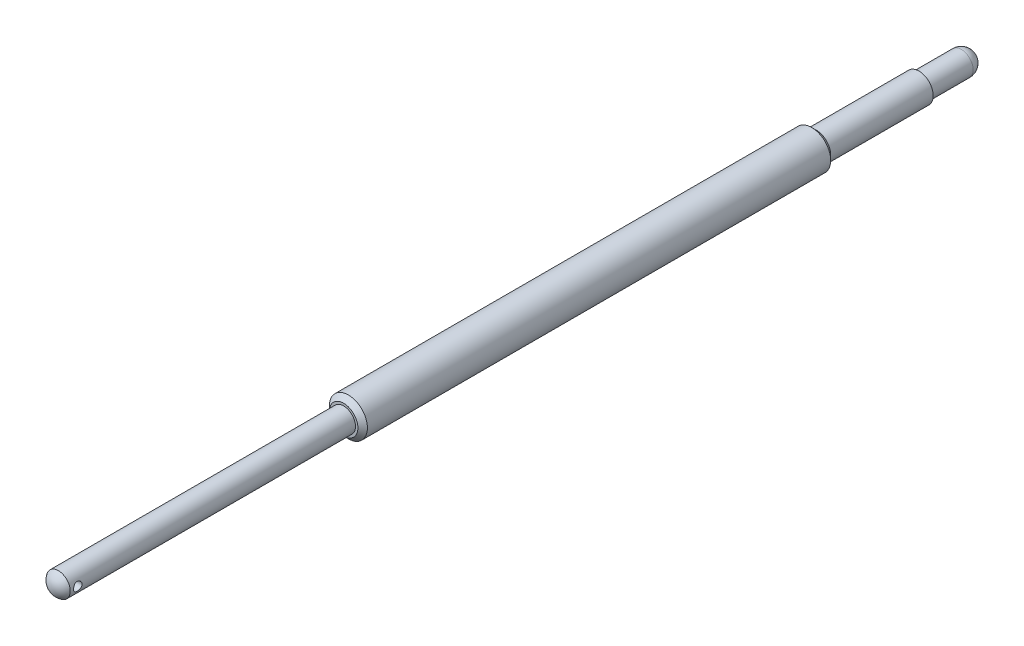
from build123d import *

# Parameters (mm, degrees)
CHAMFER1_SIZE           = 0.5
CUT_EXTRUDE1_DEPTH      = 67.260395411
CUT_EXTRUDE1_DEPTH_BACK = 67.260395411
SKETCH3_R               = 0.45


with BuildPart() as part:
    # Sketch2 → Revolve1 (revolve)
    with BuildSketch(Plane(origin=(0, 0, 0), x_dir=(0, 0, -1), z_dir=(1, 0, 0)), mode=Mode.PRIVATE) as revolve1_sk:
        with BuildLine():
            Line((-29.233928571, 0), (65.5, 0))
            Line((65.5, 0), (66.2, 0))
            ThreePointArc((66.2, 0), (65.833883476, -0.883883476), (64.95, -1.25))
            Line((64.95, -1.25), (60.5, -1.25))
            Line((60.5, -1.25), (60.5, -1.5))
            Line((60.5, -1.5), (49.719225947, -1.5))
            Line((49.719225947, -1.5), (49.719225947, -2))
            Line((49.719225947, -2), (0, -2))
            Line((0, -2), (0, -1.25))
            Line((0, -1.25), (-5, -1.25))
            Line((-5, -1.25), (-30, -1.25))
            ThreePointArc((-30, -1.25), (-30.513084713, -0.716327439), (-30.7, 0))
            Line((-30.7, 0), (-29.233928571, 0))
        make_face()
    revolve(revolve1_sk.sketch.rotate(Axis((0, 0, 29.233928571), (0, 0, -1)), 270), axis=Axis((0, 0, 29.233928571), (0, 0, -1)))

    # Chamfer1
    chamfer1_edges = [part.edges().sort_by_distance(p)[0] for p in [
        (-2, 0, -49.719225947),
        (-2, 0, 0),
    ]]
    chamfer(chamfer1_edges, length=CHAMFER1_SIZE - 0.0001)  # a hair under: the kernel refuses the full size

    # Sketch3 → Cut-Extrude1 (cut, two sides: drawn at the far end of the back side and taken through both)
    with BuildSketch(Plane(origin=(0, 0, 0), x_dir=(0, 0, -1), z_dir=(1, 0, 0)).offset(-CUT_EXTRUDE1_DEPTH_BACK)):
        with Locations((-29.2, 0)):
            Circle(SKETCH3_R)
    extrude(amount=CUT_EXTRUDE1_DEPTH + CUT_EXTRUDE1_DEPTH_BACK, mode=Mode.SUBTRACT)


solid = part.part
